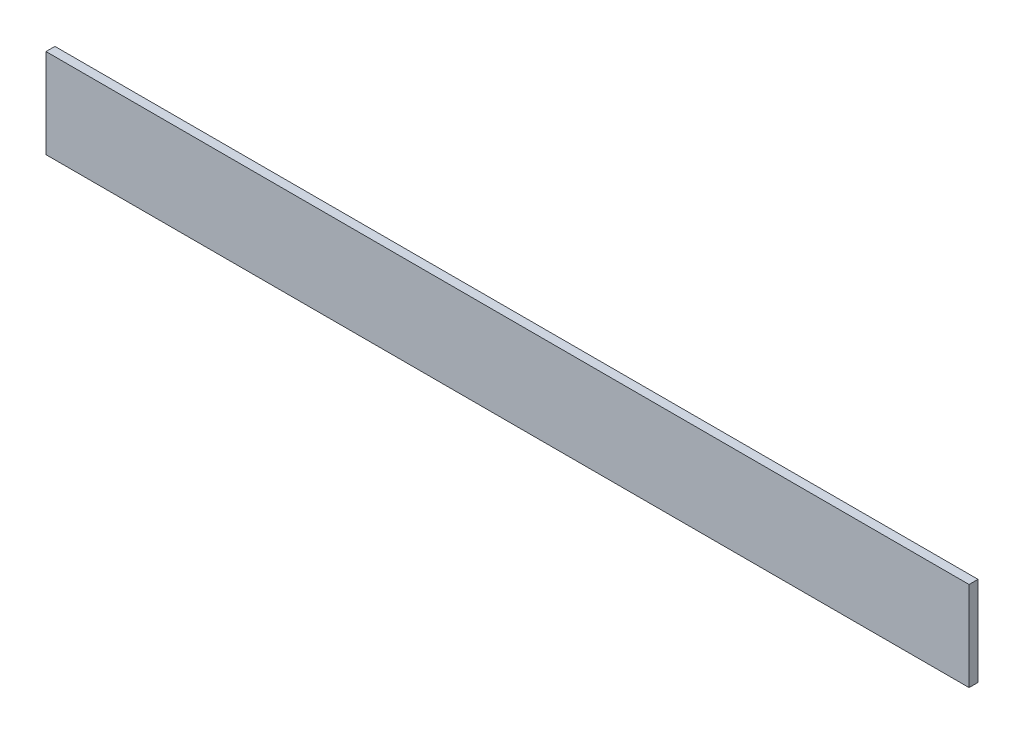
from build123d import *

# Parameters (mm, degrees)
EXTRUDE_1_DEPTH     = 310
SKETCH_2_W          = 27
SKETCH_2_H          = 27
CUT_EXTRUDE_1_DEPTH = 313.889756943


with BuildPart() as part:
    # Эскиз1 → Вытянуть-Тонкостенный1 (new body)
    with BuildSketch(Plane(origin=(0, 0, 0), x_dir=(0, 0, -1), z_dir=(1, 0, 0))):
        Polygon((0, 30), (0, 0), (30, 0), (30, 3), (3, 3), (3, 30), align=None)
    extrude(amount=EXTRUDE_1_DEPTH)

    # Эскиз2 → Вырез-Вытянуть1 (cut, through all)
    with BuildSketch(Plane.XZ):
        with Locations((296.5, -16.5)):
            Rectangle(SKETCH_2_W, SKETCH_2_H)
    extrude(amount=-CUT_EXTRUDE_1_DEPTH, mode=Mode.SUBTRACT)


solid = part.part
